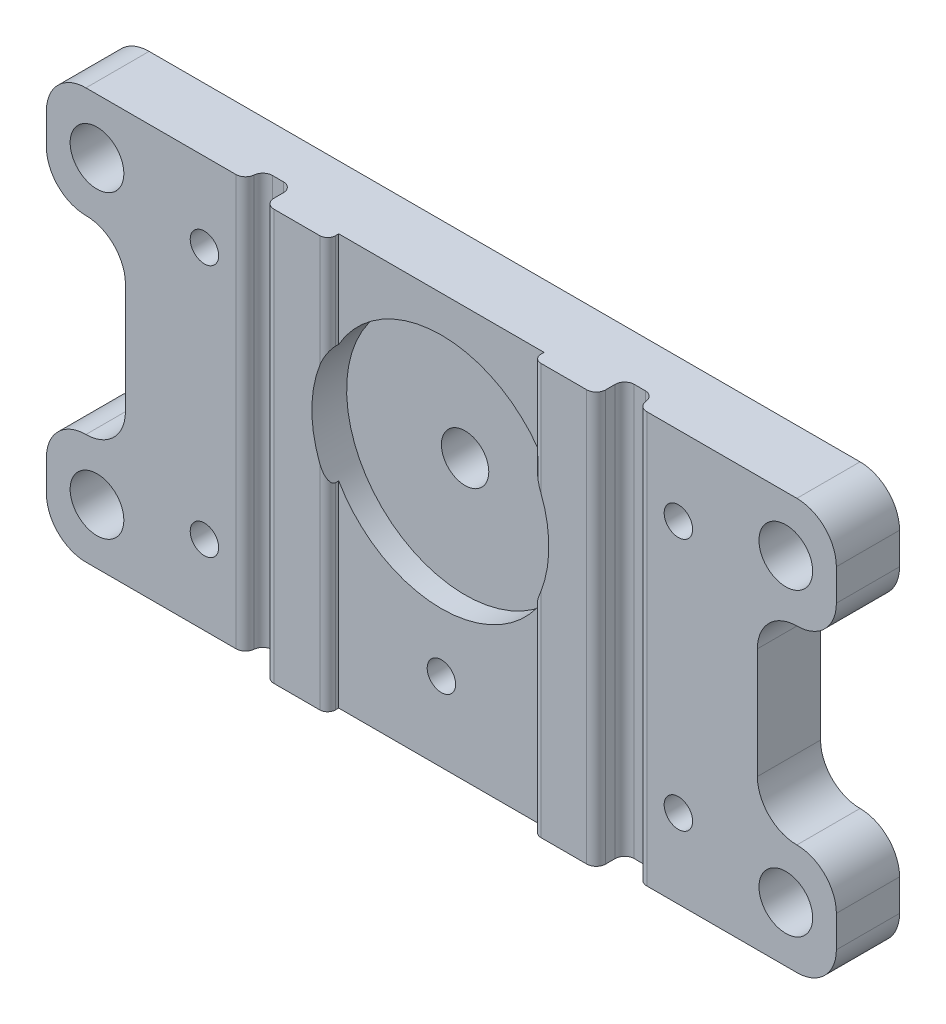
from build123d import *

# Parameters (mm, degrees)
BODY_S_W                    = 40
BODY_S_H                    = 26
BODY_S_R                    = 0.9
BODY_DEPTH                  = 2
CUTTING_S_R                 = 3.5
CUTTING_DEPTH               = 3
WING_S_W                    = 5
WING_S_H                    = 7
WING_S_R                    = 1.7
WING_DEPTH                  = 4
LINEARES_MUSTER2_COUNT      = 2
LINEARES_MUSTER2_PITCH      = 19
VERRUNDUNG2_R               = 2.5
GLIDES_S_W                  = 9.2
GLIDES_S_H                  = 26
GLIDES_DEPTH                = 0.7
GEAR_H_R                    = 7.5
GEARHOLE_DEPTH              = 1.5
SHAFT_BORE_DEPTH            = 29.460498942
SHAFT_BORE_DEPTH_BACK       = 29.460498942
BORE_S_R                    = 1.5
FASE2_SIZE                  = 3
FASE3_SIZE                  = 3
RAILCUT_W                   = 1.9
RAILCUT_H                   = 26
RAIL_CUT_DEPTH              = 1.8
EDGE_2_W                    = 0.3
EDGE_2_H                    = 26
CUT_EDGE_DEPTH              = 0.7
VERRUNDUNG6_R               = 0.6
VERRUNDUNG7_R               = 0.6
VERRUNDUNG8_R               = 0.6
GLIDE_SPACE_W               = 3
GLIDE_SPACE_H               = 26
GLIDE_SPACE_RACK_SPUR_DEPTH = 0.7
VERRUNDUNG10_R              = 0.5
VERRUNDUNG11_R              = 0.5
VERRUNDUNG12_R              = 0.5


# Some blends are built 0.0001 mm under size
with BuildPart() as part:
    # body-s → body (new, symmetric)
    with BuildSketch(Plane.XY):
        Rectangle(BODY_S_W, BODY_S_H)
        with Locations((-15, 8)):
            Circle(BODY_S_R, mode=Mode.SUBTRACT)
        with Locations((15, 8)):
            Circle(BODY_S_R, mode=Mode.SUBTRACT)
        with Locations((15, -8)):
            Circle(BODY_S_R, mode=Mode.SUBTRACT)
        with Locations((-15, -8)):
            Circle(BODY_S_R, mode=Mode.SUBTRACT)
        with Locations((0, -8)):
            Circle(BODY_S_R, mode=Mode.SUBTRACT)
    extrude(amount=BODY_DEPTH, both=True)

    # cutting-s → cutting (cut)
    with BuildSketch(Plane(origin=(0, 0, -2), x_dir=(-1, 0, 0), z_dir=(0, 0, -1))):
        with Locations((-15, 8)):
            Circle(CUTTING_S_R)
        with Locations((15, 8)):
            Circle(CUTTING_S_R)
        with Locations((15, -8)):
            Circle(CUTTING_S_R)
        with Locations((-15, -8)):
            Circle(CUTTING_S_R)
        with Locations((0, -8)):
            Circle(CUTTING_S_R)
    extrude(amount=-CUTTING_DEPTH, mode=Mode.SUBTRACT)

    # wing-s → wing (add)
    # profile 1 of 2: a face of its own
    with BuildSketch(Plane.XY.offset(2)):
        with Locations((-22.5, 9.5)):
            Rectangle(WING_S_W, WING_S_H)
        with Locations((-21.8, 9.5)):
            Circle(WING_S_R, mode=Mode.SUBTRACT)
    # profile 2 of 2: a face of its own
    with BuildSketch(Plane.XY.offset(2)):
        with Locations((22.5, 9.5)):
            Rectangle(WING_S_W, WING_S_H)
        with Locations((21.8, 9.5)):
            Circle(WING_S_R, mode=Mode.SUBTRACT)
    wing = extrude(amount=-WING_DEPTH)

    # Lineares Muster2: wing ×2
    with Locations(*[(0, -i * LINEARES_MUSTER2_PITCH, 0) for i in range(1, LINEARES_MUSTER2_COUNT)]):
        add(wing)

    # Verrundung2
    verrundung2_edges = [part.edges().sort_by_distance(p)[0] for p in [
        (25, -13, 0),
        (25, -6, 0),
        (-25, -6, 0),
        (-25, -13, 0),
        (-20, -6, 0),
        (-20, 6, 0),
        (-25, 6, 0),
        (-25, 13, 0),
        (25, 13, 0),
        (20, -6, 0),
        (20, 6, 0),
        (25, 6, 0),
    ]]
    fillet(verrundung2_edges, radius=VERRUNDUNG2_R - 0.0001)  # a hair under: the kernel refuses the full size

    # glides-s → glides (add)
    with BuildSketch(Plane.XY.offset(2)):
        with Locations((-8.1, 0)):
            Rectangle(GLIDES_S_W, GLIDES_S_H)
        with Locations((8.1, 0)):
            Rectangle(GLIDES_S_W, GLIDES_S_H)
    extrude(amount=GLIDES_DEPTH)

    # gear-h → gearhole (cut, symmetric)
    with BuildSketch(Plane.XY.offset(2)):
        with Locations(Location((0, 3.2, 0), (0, 0, 117.818139285))):
            Circle(GEAR_H_R)
    extrude(amount=GEARHOLE_DEPTH, both=True, mode=Mode.SUBTRACT)

    # bore-s → Shaft-bore (cut, two sides: drawn at the far end of the back side and taken through both)
    with BuildSketch(Plane.XY.offset(2).offset(-SHAFT_BORE_DEPTH_BACK)):
        with Locations((0, 3.2)):
            Circle(BORE_S_R)
    extrude(amount=SHAFT_BORE_DEPTH + SHAFT_BORE_DEPTH_BACK, mode=Mode.SUBTRACT)

    # Fase2
    # the kernel refuses this chamfer: 3 mm, written as the material it adds along each edge
    with BuildSketch(Plane(origin=(15, 8, 1), x_dir=(-1, 0, 0), z_dir=(0, -1, 0))) as fase2_piece_1_section:
        Polygon((3.5, FASE2_SIZE), (3.5 - FASE2_SIZE, 0), (3.5, 0), align=None)
    fase2_piece_1 = revolve(axis=Axis((15, 8, 1), (0, 0, -1)), mode=Mode.PRIVATE)
    fase2_piece_1 = split(fase2_piece_1, bisect_by=Plane(origin=(17.230122029, 8, -2), z_dir=(0, 0, 1)), keep=Keep.TOP, mode=Mode.PRIVATE)
    fase2_piece_1 = fase2_piece_1 - Plane(origin=(15, 8, -0.669877971), x_dir=(1, 0, 0), z_dir=(0, 0, -1)) * Cylinder(0.9, 14, mode=Mode.PRIVATE)
    add(fase2_piece_1)

    # Fase3
    # the kernel refuses this chamfer: 3 mm, written as the material it adds along each edge
    with BuildSketch(Plane(origin=(-15, -8, 1), x_dir=(-1, 0, 0), z_dir=(0, -1, 0))) as fase3_piece_1_section:
        Polygon((3.5, FASE3_SIZE), (3.5 - FASE3_SIZE, 0), (3.5, 0), align=None)
    fase3_piece_1 = revolve(axis=Axis((-15, -8, 1), (0, 0, -1)), mode=Mode.PRIVATE)
    fase3_piece_1 = split(fase3_piece_1, bisect_by=Plane(origin=(-12.769877971, -8, -2), z_dir=(0, 0, 1)), keep=Keep.TOP, mode=Mode.PRIVATE)
    fase3_piece_1 = fase3_piece_1 - Plane(origin=(-15, -8, -0.669877971), x_dir=(1, 0, 0), z_dir=(0, 0, -1)) * Cylinder(0.9, 14, mode=Mode.PRIVATE)
    add(fase3_piece_1)
    with BuildSketch(Plane(origin=(-15, 8, 1), x_dir=(-1, 0, 0), z_dir=(0, -1, 0))) as fase3_piece_2_section:
        Polygon((3.5, FASE3_SIZE), (3.5 - FASE3_SIZE, 0), (3.5, 0), align=None)
    fase3_piece_2 = revolve(axis=Axis((-15, 8, 1), (0, 0, -1)), mode=Mode.PRIVATE)
    fase3_piece_2 = split(fase3_piece_2, bisect_by=Plane(origin=(-12.769877971, 8, -2), z_dir=(0, 0, 1)), keep=Keep.TOP, mode=Mode.PRIVATE)
    fase3_piece_2 = fase3_piece_2 - Plane(origin=(-15, 8, -0.669877971), x_dir=(1, 0, 0), z_dir=(0, 0, -1)) * Cylinder(0.9, 14, mode=Mode.PRIVATE)
    add(fase3_piece_2)
    with BuildSketch(Plane(origin=(0, -8, 1), x_dir=(-1, 0, 0), z_dir=(0, -1, 0))) as fase3_piece_3_section:
        Polygon((3.5, FASE3_SIZE), (3.5 - FASE3_SIZE, 0), (3.5, 0), align=None)
    fase3_piece_3 = revolve(axis=Axis((0, -8, 1), (0, 0, -1)), mode=Mode.PRIVATE)
    fase3_piece_3 = split(fase3_piece_3, bisect_by=Plane(origin=(2.230122029, -8, -2), z_dir=(0, 0, 1)), keep=Keep.TOP, mode=Mode.PRIVATE)
    fase3_piece_3 = fase3_piece_3 - Plane(origin=(0, -8, -0.669877971), x_dir=(1, 0, 0), z_dir=(0, 0, -1)) * Cylinder(0.9, 14, mode=Mode.PRIVATE)
    add(fase3_piece_3)
    with BuildSketch(Plane(origin=(15, -8, 1), x_dir=(-1, 0, 0), z_dir=(0, -1, 0))) as fase3_piece_4_section:
        Polygon((3.5, FASE3_SIZE), (3.5 - FASE3_SIZE, 0), (3.5, 0), align=None)
    fase3_piece_4 = revolve(axis=Axis((15, -8, 1), (0, 0, -1)), mode=Mode.PRIVATE)
    fase3_piece_4 = split(fase3_piece_4, bisect_by=Plane(origin=(17.230122029, -8, -2), z_dir=(0, 0, 1)), keep=Keep.TOP, mode=Mode.PRIVATE)
    fase3_piece_4 = fase3_piece_4 - Plane(origin=(15, -8, -0.669877971), x_dir=(1, 0, 0), z_dir=(0, 0, -1)) * Cylinder(0.9, 14, mode=Mode.PRIVATE)
    add(fase3_piece_4)

    # railcut → rail-cut (cut)
    with BuildSketch(Plane.XY.offset(2.7)):
        with Locations((-11.45, 0)):
            Rectangle(RAILCUT_W, RAILCUT_H)
        with Locations((11.45, 0)):
            Rectangle(RAILCUT_W, RAILCUT_H)
    extrude(amount=-RAIL_CUT_DEPTH, mode=Mode.SUBTRACT)

    # edge 2 → cut-edge (cut)
    with BuildSketch(Plane.XY.offset(2.7)):
        with Locations((-12.55, 0)):
            Rectangle(EDGE_2_W, EDGE_2_H)
        with Locations((12.55, 0)):
            Rectangle(EDGE_2_W, EDGE_2_H)
    extrude(amount=-CUT_EDGE_DEPTH, mode=Mode.SUBTRACT)

    # Verrundung6
    verrundung6_edges = [part.edges().sort_by_distance(p)[0] for p in [
        (-12.4, 0, 2),
        (12.4, 0, 2),
    ]]
    fillet(verrundung6_edges, radius=VERRUNDUNG6_R)

    # Verrundung7
    verrundung7_edges = [part.edges().sort_by_distance(p)[0] for p in [
        (12.4, 0, 0.9),
        (10.5, 0, 0.9),
        (-12.4, 0, 0.9),
        (-10.5, 0, 0.9),
    ]]
    fillet(verrundung7_edges, radius=VERRUNDUNG7_R)

    # Verrundung8
    verrundung8_edges = [part.edges().sort_by_distance(p)[0] for p in [
        (-10.5, 0, 2.7),
        (10.5, 0, 2.7),
    ]]
    fillet(verrundung8_edges, radius=VERRUNDUNG8_R)

    # glide-space → glide-space-rack-spur (cut)
    with BuildSketch(Plane.XY.offset(2.7)):
        with Locations((-5, 0)):
            Rectangle(GLIDE_SPACE_W, GLIDE_SPACE_H)
        with Locations((5, 0)):
            Rectangle(GLIDE_SPACE_W, GLIDE_SPACE_H)
    extrude(amount=-GLIDE_SPACE_RACK_SPUR_DEPTH, mode=Mode.SUBTRACT)

    # Verrundung10
    verrundung10_edges = [part.edges().sort_by_distance(p)[0] for p in [
        (-6.5, 9.970828693, 2.7),
    ]]
    fillet(verrundung10_edges, radius=VERRUNDUNG10_R)

    # Verrundung11
    verrundung11_edges = [part.edges().sort_by_distance(p)[0] for p in [
        (-6.5, -6.770828693, 2.7),
    ]]
    fillet(verrundung11_edges, radius=VERRUNDUNG11_R)

    # Verrundung12
    verrundung12_edges = [part.edges().sort_by_distance(p)[0] for p in [
        (6.5, 9.970828693, 2.7),
        (6.5, -6.770828693, 2.7),
    ]]
    fillet(verrundung12_edges, radius=VERRUNDUNG12_R)


solid = part.part
